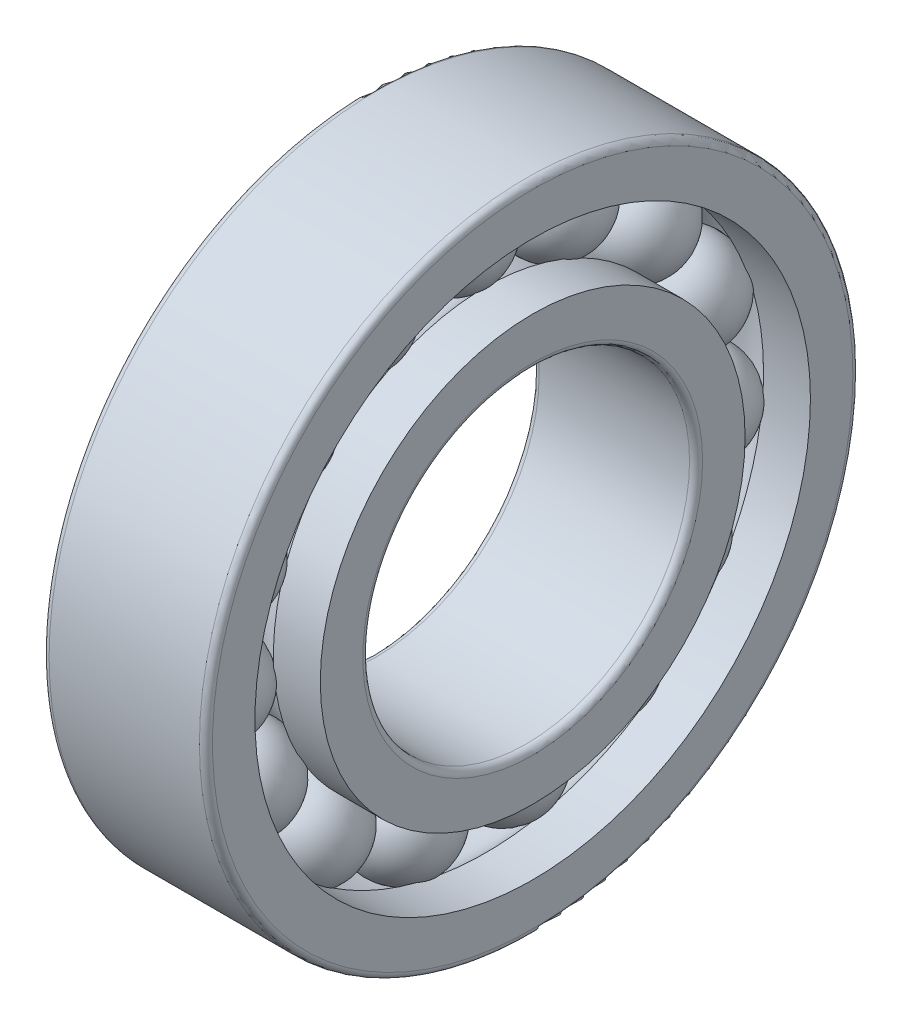
from build123d import *

# Parameters (mm, degrees)
CAGSPISKE_W         = 0.1905
CAGSPISKE_H         = 0.3175
CAGESPINE_ANGLE     = 0.001
BALLSDETAILED_COUNT = 15
BALLSDETAILED_ANGLE = 336


with BuildPart() as part:
    # CagSpiSke → CageSpine (revolve)
    with BuildSketch(Plane.XY):
        with Locations((0, 4.7625)):
            Rectangle(CAGSPISKE_W, CAGSPISKE_H)
    revolve(axis=Axis((-20.6375, 0, 0), (-1, 0, 0)), revolution_arc=CAGESPINE_ANGLE)

    # BalDetSke → BallDetailed (revolve)
    with BuildSketch(Plane.XY):
        with BuildLine():
            Line((-0.9525, 4.7625), (0.9525, 4.7625))
            ThreePointArc((0.9525, 4.7625), (0, 3.81), (-0.9525, 4.7625))
        make_face()
    balldetailed = revolve(axis=Axis((-1.905, 4.7625, 0), (1, 0, 0)))

    # InnRacSke → InnerRace (revolve)
    with BuildSketch(Plane.XY):
        with BuildLine():
            Line((-0.676040864, 4.1275), (-1.5875, 4.1275))
            Line((-1.5875, 4.1275), (-1.5875, 3.302))
            ThreePointArc((-1.5875, 3.302), (-1.550302561, 3.212197439), (-1.4605, 3.175))
            Line((-1.4605, 3.175), (1.4605, 3.175))
            ThreePointArc((1.4605, 3.175), (1.550302561, 3.212197439), (1.5875, 3.302))
            Line((1.5875, 3.302), (1.5875, 4.1275))
            Line((1.5875, 4.1275), (0.676040864, 4.1275))
            ThreePointArc((0.676040864, 4.1275), (0, 3.835), (-0.676040864, 4.1275))
        make_face()
    revolve(axis=Axis((-20.6375, 0, 0), (1, 0, 0)))

    # OutRacSke → OuterRace (revolve)
    with BuildSketch(Plane.XY):
        with BuildLine():
            Line((-0.676040864, 5.3975), (-1.5875, 5.3975))
            Line((-1.5875, 5.3975), (-1.5875, 6.223))
            ThreePointArc((-1.5875, 6.223), (-1.550302561, 6.312802561), (-1.4605, 6.35))
            Line((-1.4605, 6.35), (1.4605, 6.35))
            ThreePointArc((1.4605, 6.35), (1.550302561, 6.312802561), (1.5875, 6.223))
            Line((1.5875, 6.223), (1.5875, 5.3975))
            Line((1.5875, 5.3975), (0.676040864, 5.3975))
            ThreePointArc((0.676040864, 5.3975), (0, 5.69), (-0.676040864, 5.3975))
        make_face()
    revolve(axis=Axis((-20.6375, 0, 0), (1, 0, 0)))

    # BallsDetailed: BallDetailed ×15 about axis
    ballsdetailed_axis = Axis((-50, 0, 0), (1, 0, 0))
    for i in range(1, BALLSDETAILED_COUNT):
        add(balldetailed.rotate(ballsdetailed_axis, i * BALLSDETAILED_ANGLE / (BALLSDETAILED_COUNT - 1)))


solid = part.part
